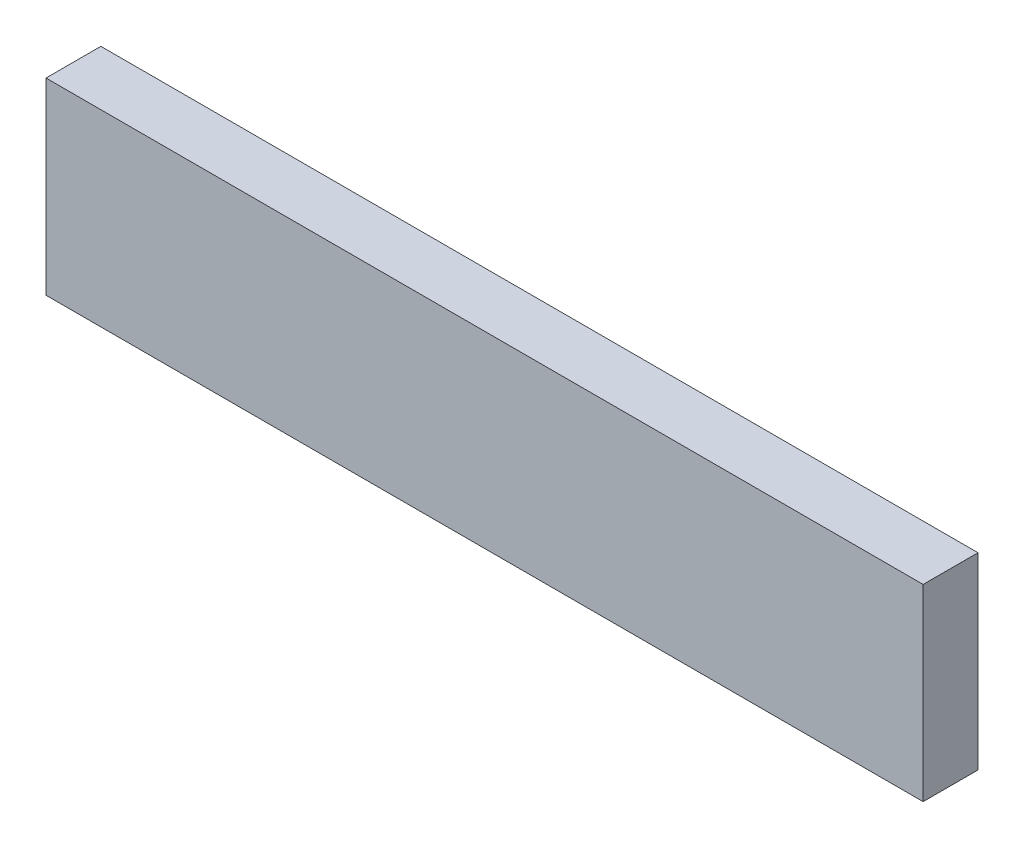
from build123d import *

# Parameters (mm, degrees)
SKETCH1_W           = 355.25024073
SKETCH1_H           = 22.225
BOSS_EXTRUDE1_DEPTH = 38.1


with BuildPart() as part:
    # Sketch1 → Boss-Extrude1 (new, symmetric)
    with BuildSketch(Plane(origin=(0, 0, 0), x_dir=(1, 0, 0), z_dir=(0, 1, 0))):
        Rectangle(SKETCH1_W, SKETCH1_H)
    extrude(amount=BOSS_EXTRUDE1_DEPTH, both=True)


solid = part.part
